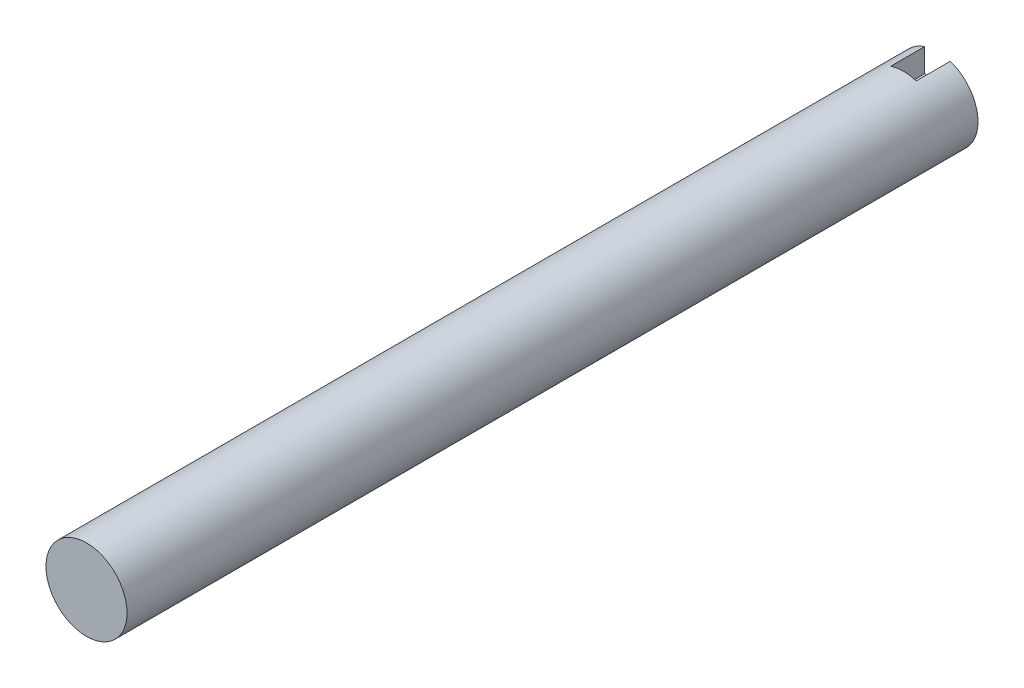
from build123d import *

# Parameters (mm, degrees)
SKETCH1_R           = 4.7625
BOSS_EXTRUDE1_DEPTH = 100
CUT_EXTRUDE1_DEPTH  = 4


with BuildPart() as part:
    # Sketch1 → Boss-Extrude1 (new body)
    with BuildSketch(Plane.XY):
        Circle(SKETCH1_R)
    extrude(amount=BOSS_EXTRUDE1_DEPTH)

    # Sketch1<3> → Cut-Extrude1 (cut)
    with BuildSketch(Plane.XY):
        with BuildLine():
            ThreePointArc((1.5, 4.520111309), (0, 4.7625), (-1.5, 4.520111309))
            Line((-1.5, 4.520111309), (-1.5, 1.7625))
            Line((-1.5, 1.7625), (1.5, 1.7625))
            Line((1.5, 1.7625), (1.5, 4.520111309))
        make_face()
    extrude(amount=CUT_EXTRUDE1_DEPTH, mode=Mode.SUBTRACT)


solid = part.part
